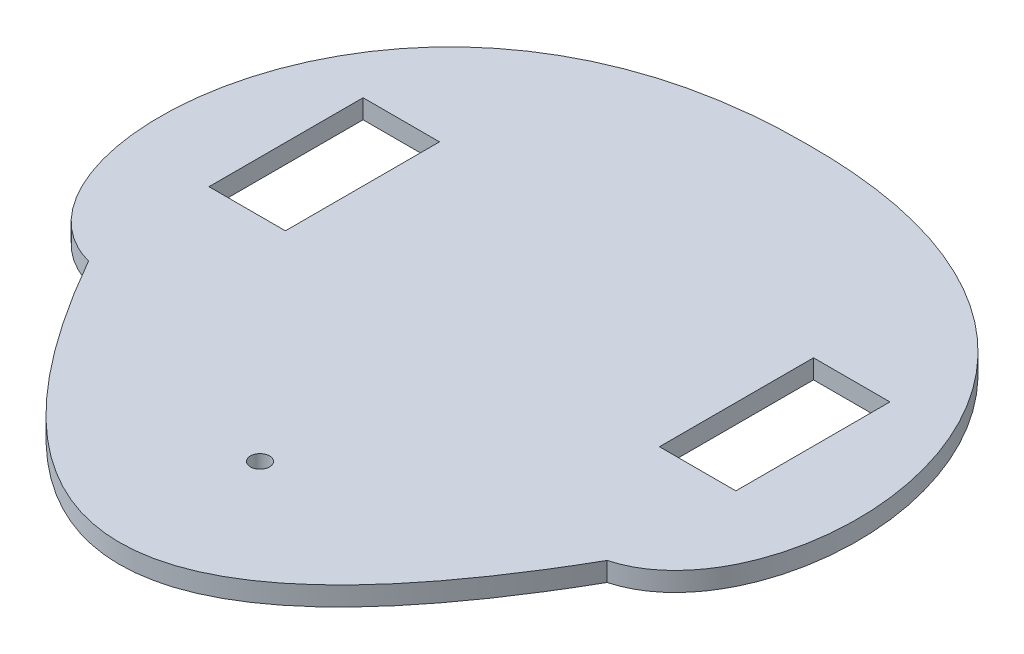
from build123d import *

# Parameters (mm, degrees)
SKETCH1_R           = 2.5
SKETCH1_W           = 19.973586183
SKETCH1_H           = 40.27128645
SKETCH1_W_2         = 19.973586184
BOSS_EXTRUDE1_DEPTH = 5


with BuildPart() as part:
    # Sketch1 → Boss-Extrude1 (new body)
    with BuildSketch(Plane(origin=(0, 0, 0), x_dir=(1, 0, 0), z_dir=(0, 1, 0))):
        with BuildLine():
            add(Edge.make_bspline(
                [(-76.437646189, 0), (-8.67851917, -119.308994617), (59.080607849, 0)],
                knots=[0, 0, 0, 1, 1, 1], degree=2))
            add(Edge.make_bspline(
                [(59.080607849, 0), (98.474622757, 10.554607194), (95.525793783, 121.071321574), (-8.67851917, 120.345502692)],
                knots=[0, 0, 0, 0, 1, 1, 1, 1], degree=3))
            add(Edge.make_bspline(
                [(-76.437646189, 0), (-115.831661097, 10.554607194), (-112.882832123, 121.071321574), (-8.67851917, 120.345502692)],
                knots=[0, 0, 0, 0, 1, 1, 1, 1], degree=3))
        make_face()
        with Locations((-8.67851917, -22.943728874)):
            Circle(SKETCH1_R, mode=Mode.SUBTRACT)
        with Locations((50.183742331, 52.701543237)):
            Rectangle(SKETCH1_W, SKETCH1_H, mode=Mode.SUBTRACT)
        with Locations((-67.540780671, 52.701543237)):
            Rectangle(SKETCH1_W_2, SKETCH1_H, mode=Mode.SUBTRACT)
    extrude(amount=BOSS_EXTRUDE1_DEPTH)


solid = part.part
